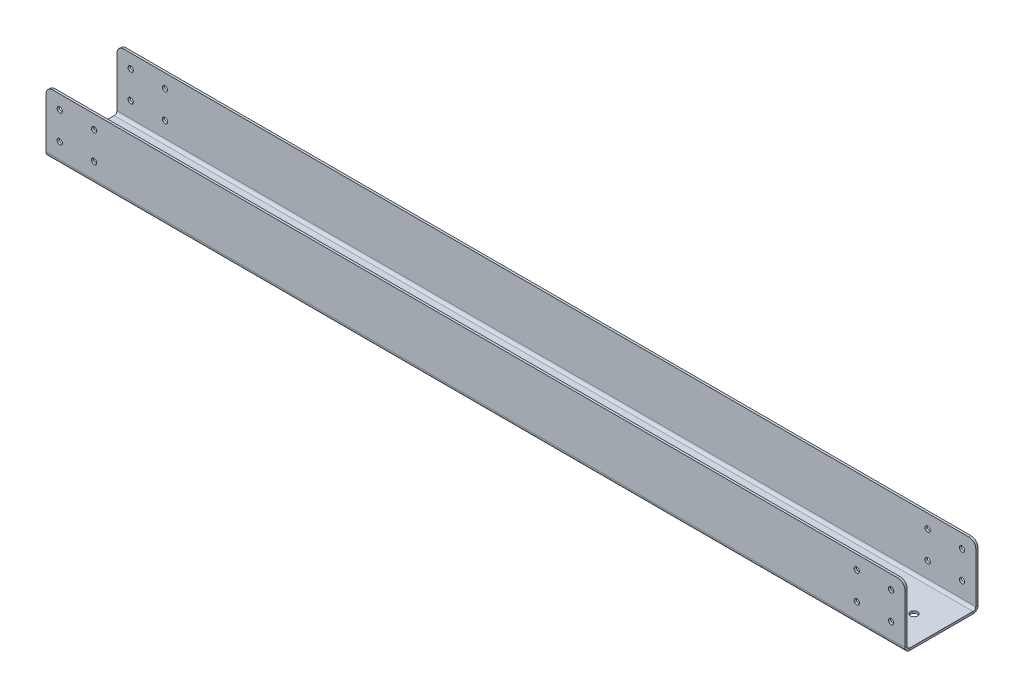
from build123d import *

# Parameters (mm, degrees)
SKETCH1_W                      = 793.75
SKETCH1_H                      = 63.5
BASE_FLANGE1_DEPTH             = 2.05232
EDGE_FLANGE1_STRIP_W           = 13.28928
EDGE_FLANGE1_STRIP_H           = 2.05232
EDGE_FLANGE1_STRIP_CUT_DEPTH   = 793.75
EDGE_FLANGE1_STRIP_2_W         = 13.28928
EDGE_FLANGE1_STRIP_2_H         = 2.05232
EDGE_FLANGE1_STRIP_CUT_2_DEPTH = 793.75
EDGE_FLANGE1_DEPTH             = 793.75
EDGE_FLANGE1_BEND_DEPTH        = 793.75
F_10_0_1935_DIAMETER_HOLE1_D   = 4.9149
BREAK_CORNER1_START            = -65.55232
BREAK_CORNER1_DEPTH            = 67.60464
F_1_4_CLEARANCE_HOLE1_D        = 6.7564


# Read off the part's stored shape, not the designer's step: Break-Corner1
# Sheet-metal steps are written as plain solids
with BuildPart() as part:
    # Sketch1 → Base-Flange1 (new body)
    with BuildSketch(Plane(origin=(0, 0, 0), x_dir=(1, 0, 0), z_dir=(0, 1, 0))):
        with Locations((396.875, 31.75)):
            Rectangle(SKETCH1_W, SKETCH1_H)
    extrude(amount=-BASE_FLANGE1_DEPTH)

    # Edge-Flange1 strip (across the edge) → Edge-Flange1 strip cut (cut)
    with BuildSketch(Plane(origin=(0, 0, 0), x_dir=(0, 0, -1), z_dir=(1, 0, 0))):
        with Locations((-4.10464, -1.02616)):
            Rectangle(EDGE_FLANGE1_STRIP_W, EDGE_FLANGE1_STRIP_H)
    extrude(amount=EDGE_FLANGE1_STRIP_CUT_DEPTH, mode=Mode.SUBTRACT)

    # Edge-Flange1 strip 2 (across the edge) → Edge-Flange1 strip cut 2 (cut)
    with BuildSketch(Plane(origin=(793.75, 0, -63.5), x_dir=(0, 0, 1), z_dir=(-1, 0, 0))):
        with Locations((-4.10464, -1.02616)):
            Rectangle(EDGE_FLANGE1_STRIP_2_W, EDGE_FLANGE1_STRIP_2_H)
    extrude(amount=EDGE_FLANGE1_STRIP_CUT_2_DEPTH, mode=Mode.SUBTRACT)

    # Edge-Flange1 section (across the edge) → Edge-Flange1 (add)
    with BuildSketch(Plane(origin=(0, 0, 0), x_dir=(0, 0, -1), z_dir=(1, 0, 0))):
        with BuildLine():
            Line((-2.05232, 2.54), (-2.05232, 55.09768))
            Line((-2.05232, 55.09768), (0, 55.09768))
            Line((0, 55.09768), (0, 2.54))
            ThreePointArc((0, 2.54), (0.743948776, 0.743948776), (2.54, 0))
            Line((2.54, 0), (2.54, -2.05232))
            ThreePointArc((2.54, -2.05232), (-0.707260613, -0.707260613), (-2.05232, 2.54))
        make_face()
    extrude(amount=EDGE_FLANGE1_DEPTH)

    # Edge-Flange1 section 2 (across the edge) → Edge-Flange1 bend (add)
    with BuildSketch(Plane(origin=(793.75, 0, -63.5), x_dir=(0, 0, 1), z_dir=(-1, 0, 0))):
        with BuildLine():
            Line((-2.05232, 2.54), (-2.05232, 55.09768))
            Line((-2.05232, 55.09768), (0, 55.09768))
            Line((0, 55.09768), (0, 2.54))
            ThreePointArc((0, 2.54), (0.743948776, 0.743948776), (2.54, 0))
            Line((2.54, 0), (2.54, -2.05232))
            ThreePointArc((2.54, -2.05232), (-0.707260613, -0.707260613), (-2.05232, 2.54))
        make_face()
    extrude(amount=EDGE_FLANGE1_BEND_DEPTH)

    # #10 (0.1935) Diameter Hole1 (through all)
    with Locations(Plane.XY.offset(2.05232)):
        with Locations((12.7, 42.39768), (12.7, 16.99768), (44.45, 42.39768), (44.45, 16.99768), (749.3, 16.99768), (781.05, 16.99768), (781.05, 42.39768), (749.3, 42.39768)):
            Hole(F_10_0_1935_DIAMETER_HOLE1_D / 2)

    # Break-Corner1 outline → Break-Corner1 (cut)
    with BuildSketch(Plane.XY.offset(BREAK_CORNER1_START)):
        with BuildLine():
            ThreePointArc((0, 48.74768), (1.859871939, 53.237808061), (6.35, 55.09768))
            Line((6.35, 55.09768), (0, 55.09768))
            Line((0, 55.09768), (0, 48.74768))
        make_face()
        with BuildLine():
            ThreePointArc((787.4, 55.09768), (791.890128061, 53.237808061), (793.75, 48.74768))
            Line((793.75, 48.74768), (793.75, 55.09768))
            Line((793.75, 55.09768), (787.4, 55.09768))
        make_face()
    extrude(amount=BREAK_CORNER1_DEPTH, mode=Mode.SUBTRACT)

    # 1/4 Clearance Hole1 (through all)
    with Locations(Plane(origin=(0, 0, 0), x_dir=(1, 0, 0), z_dir=(0, 1, 0))):
        with Locations((219.075, 31.75), (574.675, 31.75), (25.4, 31.75), (768.35, 31.75)):
            Hole(F_1_4_CLEARANCE_HOLE1_D / 2)


solid = part.part
